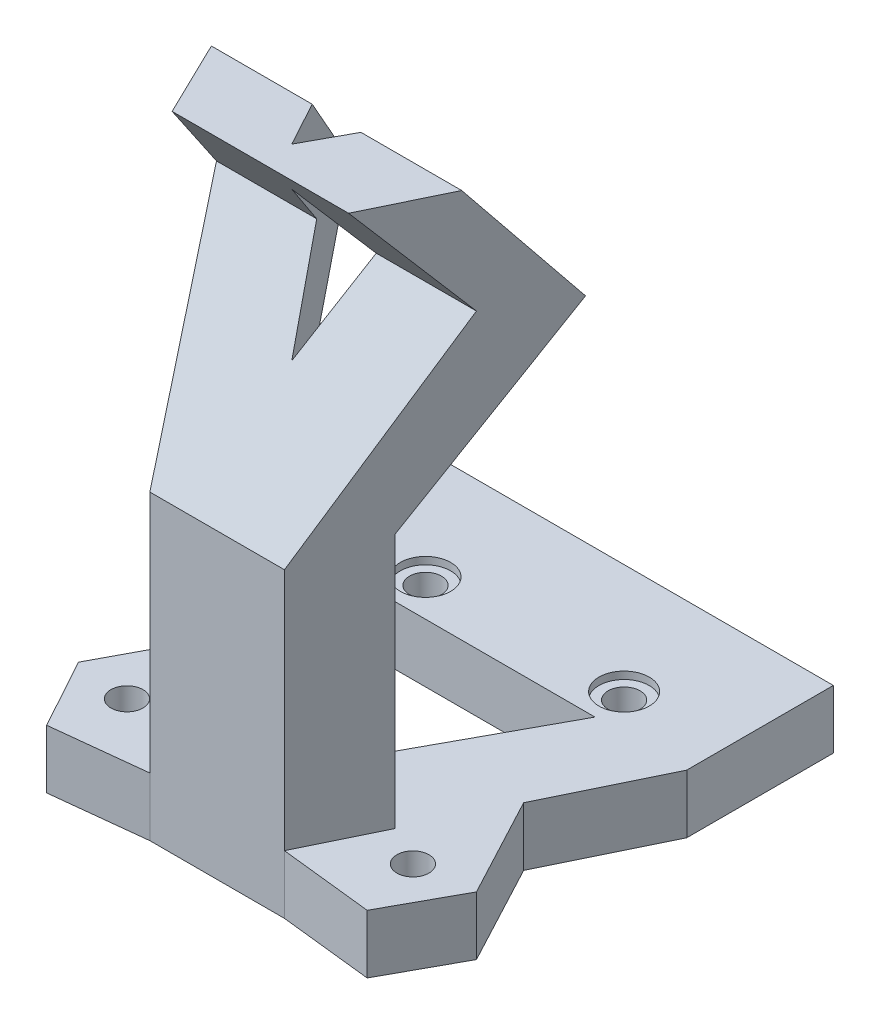
from build123d import *

# Parameters (mm, degrees)
SKETCH2_W           = 54.2
SKETCH2_H           = 20
BOSS_EXTRUDE1_DEPTH = 8
SKETCH4_R           = 2.1825
CUT_EXTRUDE1_DEPTH  = 10
BOSS_EXTRUDE2_DEPTH = 3
BOSS_EXTRUDE4_DEPTH = 28
CUT_EXTRUDE2_DEPTH  = 106
BOSS_EXTRUDE5_DEPTH = 5
BOSS_EXTRUDE6_DEPTH = 8
SKETCH16_R          = 2.1825
CUT_EXTRUDE4_DEPTH  = 10
SKETCH17_R          = 3.429638921
CUT_EXTRUDE5_DEPTH  = 1


with BuildPart() as part:
    # Sketch2 → Boss-Extrude1 (new body)
    with BuildSketch(Plane(origin=(0, 0, 0), x_dir=(1, 0, 0), z_dir=(0, 1, 0))):
        with Locations((0, 10)):
            Rectangle(SKETCH2_W, SKETCH2_H)
    extrude(amount=BOSS_EXTRUDE1_DEPTH)

    # Sketch4 → Cut-Extrude1 (cut)
    with BuildSketch(Plane(origin=(0, 8, 0), x_dir=(1, 0, 0), z_dir=(0, 1, 0))):
        with Locations((13.55, 5)):
            Circle(SKETCH4_R)
        with Locations((-13.55, 5)):
            Circle(SKETCH4_R)
    extrude(amount=-CUT_EXTRUDE1_DEPTH, mode=Mode.SUBTRACT)

    # Sketch5 → Boss-Extrude2 (add)
    with BuildSketch(Plane(origin=(0, 5, 0), x_dir=(1, 0, 0), z_dir=(0, 1, 0))):
        Polygon((-27.1, 0), (-9.18232636, -36.974160152), (9.18232636, -36.974160152), (27.1, 0), (14.580002835, 0), (0, -26.793067248), (-14.580002835, 0), align=None)
    extrude(amount=BOSS_EXTRUDE2_DEPTH)

    # Sketch10 → Boss-Extrude4 (add, symmetric)
    with BuildSketch(Plane(origin=(0, 0, 0), x_dir=(0, 0, -1), z_dir=(1, 0, 0))):
        Polygon((-26.793067248, 8), (-26.793067248, 42.8), (-9.305277317, 66.433391702), (-20.681777892, 81.807849844), (-31.085611987, 81.807849844), (-19.330972069, 67.220874809), (-36.974160152, 41.198255999), (-36.974160152, 8), align=None)
    extrude(amount=BOSS_EXTRUDE4_DEPTH, both=True)

    # Sketch12 → Cut-Extrude2 (cut)
    with BuildSketch(Plane(origin=(0, 0, 0), x_dir=(1, 0, 0), z_dir=(0, 1, 0))):
        Polygon((-14.580002835, 0), (14.580002835, 0), (0, -26.793067248), align=None)
        Polygon((-27.1, 0), (-9.18232636, -36.974160152), (9.18232636, -36.974160152), (27.1, 0), (46.03867266, -38.954692391), (-49.762484342, -38.954692391), align=None)
    extrude(amount=CUT_EXTRUDE2_DEPTH, mode=Mode.SUBTRACT)

    # Sketch14 → Boss-Extrude5 (add)
    with BuildSketch(Plane(origin=(0, 0, 0), x_dir=(1, 0, 0), z_dir=(0, 1, 0))):
        Polygon((-27.1, 0), (-9.18232636, -36.974160152), (9.18232636, -36.974160152), (27.1, 0), (14.580002835, 0), (0, -26.793067248), (-14.580002835, 0), align=None)
    extrude(amount=BOSS_EXTRUDE5_DEPTH)

    # Sketch15 → Boss-Extrude6 (add)
    with BuildSketch(Plane(origin=(0, 0, 0), x_dir=(1, 0, 0), z_dir=(0, 1, 0))):
        Polygon((19.834138295, -14.993527605), (27.146381487, -28.743465458), (21.865323293, -38.374718638), (9.18232636, -36.974160152), align=None)
        Polygon((-21.865323293, -38.374718638), (-9.18232636, -36.974160152), (-19.834138295, -14.993527605), (-27.146381487, -28.743465458), align=None)
    extrude(amount=BOSS_EXTRUDE6_DEPTH)

    # Sketch16 → Cut-Extrude4 (cut)
    with BuildSketch(Plane(origin=(0, 8, 0), x_dir=(1, 0, 0), z_dir=(0, 1, 0))):
        with Locations((19.507042359, -29.771467963)):
            Circle(SKETCH16_R)
        with Locations((-19.507042359, -29.771467963)):
            Circle(SKETCH16_R)
    extrude(amount=-CUT_EXTRUDE4_DEPTH, mode=Mode.SUBTRACT)

    # Sketch17 → Cut-Extrude5 (cut)
    with BuildSketch(Plane(origin=(0, 8, 0), x_dir=(1, 0, 0), z_dir=(0, 1, 0))):
        with Locations((-13.55, 5)):
            Circle(SKETCH17_R)
        with Locations((13.55, 5)):
            Circle(SKETCH17_R)
    extrude(amount=-CUT_EXTRUDE5_DEPTH, mode=Mode.SUBTRACT)


solid = part.part
